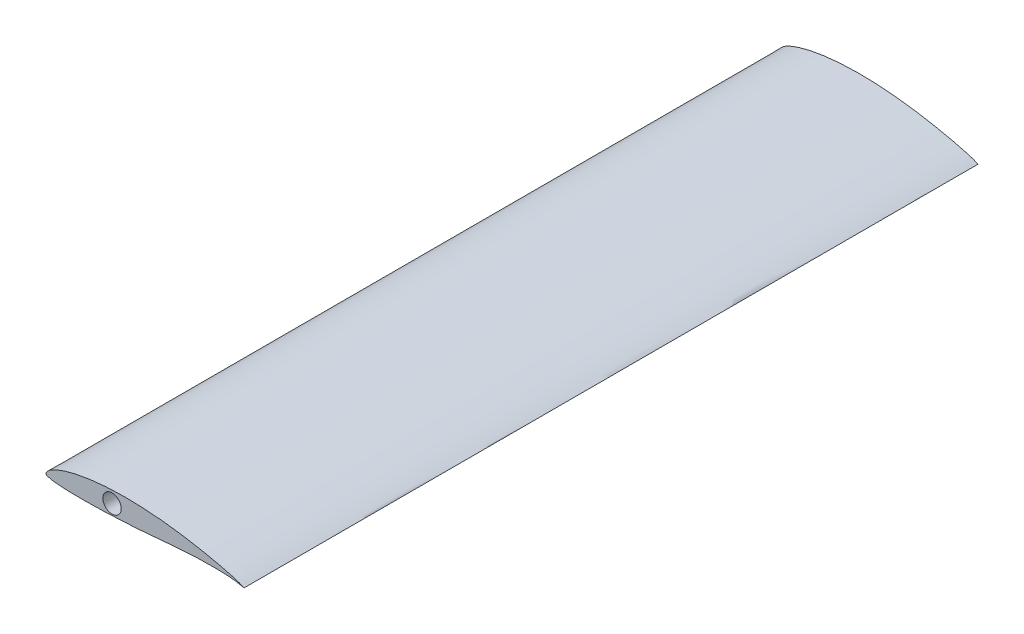
from build123d import *

# Parameters (mm, degrees)
BOSS_EXTRUDE1_DEPTH = 1000
SKETCH1_3_R         = 12.5
CUT_EXTRUDE1_DEPTH  = 1037.135587203


with BuildPart() as part:
    # Sketch1 → Boss-Extrude1 (new body)
    with BuildSketch(Plane.XY):
        with BuildLine():
            add(Edge.make_bspline(
                [(270, 0), (269.997712349, 0.023468661), (268.237544941, 0.666521839), (266.567167257, 1.466789664), (262.675565235, 3.01541236), (257.913204906, 4.572419994), (251.732046911, 6.332511181), (244.411227292, 8.237575471), (235.957624235, 10.272814456), (226.514158982, 12.38933885), (216.193353243, 14.540861966), (205.131334675, 16.677544685), (193.456704412, 18.7297696), (181.297741573, 20.632447569), (168.767775932, 22.311665368), (155.975282971, 23.707924082), (143.035274217, 24.804856211), (130.06168369, 25.580194161), (117.173431648, 26.000287002), (104.483656181, 26.057596154), (92.104375501, 25.753147531), (80.139477401, 25.074235193), (68.690037108, 24.038074266), (57.850888144, 22.669913071), (47.714343715, 21.012498661), (38.37316885, 19.087217341), (29.908423923, 16.955757767), (22.398973416, 14.644399999), (15.90790334, 12.21589514), (10.484326099, 9.720163832), (6.177015703, 7.220860756), (2.961164208, 4.741201423), (0.976626841, 2.42611563), (0.023704484, 0.790715424), (-0.016204009, -0.46972147), (0.800260735, -1.836070967), (3.492141103, -2.629537712), (7.307971652, -3.662676489), (12.656595645, -4.399117434), (19.319388615, -5.032889423), (27.290506862, -5.469798203), (36.462169983, -5.738674764), (46.741441235, -5.840005255), (58.010459053, -5.770159701), (70.143350573, -5.536829539), (83.007144053, -5.1408123), (96.462851164, -4.565906732), (110.373983662, -3.827009828), (124.616655035, -2.892998567), (139.099460234, -1.736345581), (153.734791934, -0.400812923), (168.409733753, 0.892284934), (182.93390361, 2.041435072), (197.07817006, 2.959215034), (210.604377411, 3.579037035), (223.266715876, 3.874376135), (234.84053921, 3.81861077), (245.04773169, 3.453293105), (253.778580241, 2.76286494), (260.440654454, 1.942229627), (265.781454332, 0.929874857), (267.932950881, 0.533749209), (270.002416438, -0.024789873), (270, 0)],
                knots=[0, 0, 0, 0, 0.001693524, 0.006395447, 0.013461651, 0.022753575, 0.034367307, 0.048191023, 0.064031392, 0.081680617, 0.100894124, 0.121431794, 0.143025453, 0.165434011, 0.188439039, 0.211855124, 0.235496289, 0.259143745, 0.282614908, 0.305701545, 0.328231584, 0.350030434, 0.370943883, 0.390816529, 0.409505873, 0.42685655, 0.442733385, 0.457018388, 0.46961507, 0.480449695, 0.48947186, 0.496730301, 0.502329147, 0.50625566, 0.506441945, 0.509181516, 0.513913846, 0.521178419, 0.530944157, 0.543144509, 0.557669674, 0.574383526, 0.593109554, 0.613638212, 0.635743557, 0.659184095, 0.683713689, 0.709075754, 0.735036066, 0.761429739, 0.788183766, 0.81505683, 0.841644764, 0.86751356, 0.892232409, 0.915363656, 0.936485325, 0.955199832, 0.971104187, 0.983751026, 0.992812818, 0.998211136, 1, 1, 1, 1], degree=3))
        make_face()
    extrude(amount=BOSS_EXTRUDE1_DEPTH)

    # Sketch1<3> → Cut-Extrude1 (cut, through all)
    with BuildSketch(Plane.XY):
        with Locations((90, 9.603267329)):
            Circle(SKETCH1_3_R)
    extrude(amount=CUT_EXTRUDE1_DEPTH, mode=Mode.SUBTRACT)


solid = part.part
